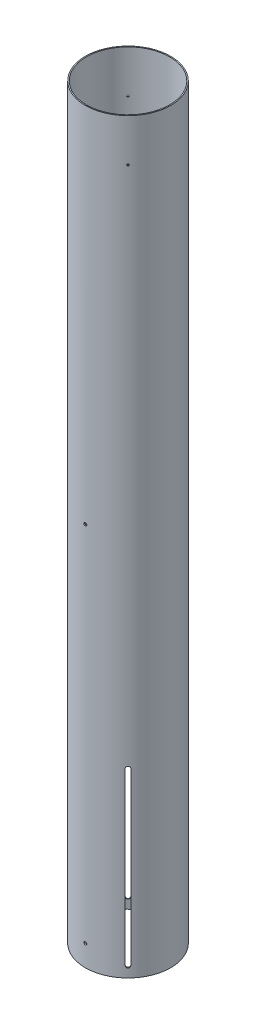
from build123d import *

# Parameters (mm, degrees)
SKETCH1_R           = 50.8
SKETCH1_R_2         = 49.53
BOSS_EXTRUDE1_DEPTH = 889
CUT_EXTRUDE1_DEPTH  = 152.4
CIRPATTERN1_COUNT   = 4
SKETCH3_R           = 1.7653
CUT_EXTRUDE2_DEPTH  = 11.684
SKETCH4_R           = 1.0922
CUT_EXTRUDE3_DEPTH  = 25.4
CIRPATTERN2_COUNT   = 2


with BuildPart() as part:
    # Sketch1 → Boss-Extrude1 (new body)
    with BuildSketch(Plane(origin=(0, 0, 0), x_dir=(1, 0, 0), z_dir=(0, 1, 0))):
        Circle(SKETCH1_R)
        Circle(SKETCH1_R_2, mode=Mode.SUBTRACT)
    extrude(amount=BOSS_EXTRUDE1_DEPTH)

    # Sketch2 → Cut-Extrude1 (cut)
    with BuildSketch(Plane(origin=(1.021732913, 1243.355570529, -179.1581259), x_dir=(0, 1, 0), z_dir=(0.7071067811865634, 0, -0.7071067811865316))):
        with BuildLine():
            Line((-1230.655570529, 128.342701458), (-1027.455570529, 128.342701458))
            ThreePointArc((-1027.455570529, 128.342701458), (-1025.074320529, 125.961451458), (-1027.455570529, 123.580201458))
            Line((-1027.455570529, 123.580201458), (-1230.655570529, 123.580201458))
            ThreePointArc((-1230.655570529, 123.580201458), (-1233.036820529, 125.961451458), (-1230.655570529, 128.342701458))
        make_face()
    cut_extrude1 = extrude(amount=-CUT_EXTRUDE1_DEPTH, mode=Mode.SUBTRACT)

    # CirPattern1: Cut-Extrude1 ×4 about axis
    cirpattern1_axis = Axis((0, 889, 0), (0, -1, 0))
    for i in range(1, CIRPATTERN1_COUNT):
        add(cut_extrude1.rotate(cirpattern1_axis, i * 360 / CIRPATTERN1_COUNT), mode=Mode.SUBTRACT)

    # Sketch3 → Cut-Extrude2 (cut)
    with BuildSketch(Plane(origin=(271.091614788, 1243.355570529, 52.3875), x_dir=(-1, 0, 0), z_dir=(0, 0, 1))):
        with Locations((271.091614788, 1217.955570529)):
            Circle(SKETCH3_R)
        with Locations((271.091614788, 786.155570529)):
            Circle(SKETCH3_R)
    extrude(amount=-CUT_EXTRUDE2_DEPTH, mode=Mode.SUBTRACT)

    # Sketch4 → Cut-Extrude3 (cut)
    with BuildSketch(Plane(origin=(120.58027232, 708.404628356, -48.738223352), x_dir=(-0.7071067811865634, 2.660214291711019e-15, 0.7071067811865317), z_dir=(0.7071067811865317, -1.2152886494782433e-14, 0.7071067811865634))):
        with Locations((119.72625647, -129.795371644)):
            Circle(SKETCH4_R)
    cut_extrude3 = extrude(amount=-CUT_EXTRUDE3_DEPTH, mode=Mode.SUBTRACT)

    # CirPattern2: Cut-Extrude3 ×2 about axis
    cirpattern2_axis = Axis((0, 889, 0), (0, -1, 0))
    for i in range(1, CIRPATTERN2_COUNT):
        add(cut_extrude3.rotate(cirpattern2_axis, i * 360 / CIRPATTERN2_COUNT), mode=Mode.SUBTRACT)


solid = part.part
